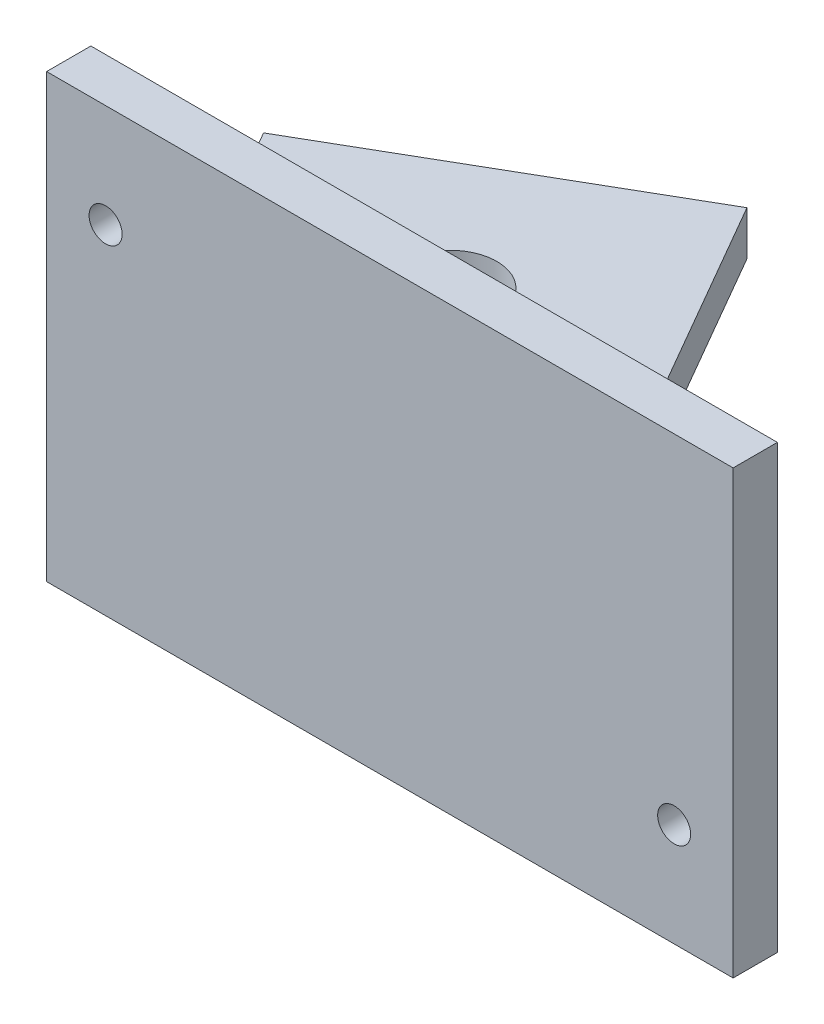
from build123d import *

# Parameters (mm, degrees)
SKETCH1_W           = 36.957
SKETCH1_H           = 21.3995
SKETCH1_R           = 0.889
BOSS_EXTRUDE1_DEPTH = 2.38125
BOSS_EXTRUDE3_DEPTH = 2.38125
CUT_EXTRUDE2_REACH  = 53.986
SKETCH4_R           = 2.4892


with BuildPart() as part:
    # Sketch1 → Boss-Extrude1 (new body)
    with BuildSketch(Plane.XY):
        with Locations((16.891, 9.11225)):
            Rectangle(SKETCH1_W, SKETCH1_H)
        with Locations((1.5875, 14.25575)):
            Circle(SKETCH1_R, mode=Mode.SUBTRACT)
        with Locations((32.1945, 1.5875)):
            Circle(SKETCH1_R, mode=Mode.SUBTRACT)
    extrude(amount=BOSS_EXTRUDE1_DEPTH)

    # Sketch2 → Boss-Extrude3 (add)
    with BuildSketch(Plane.XZ.offset(1.5875)):
        Polygon((-1.5875, 2.38125), (35.3695, 2.38125), (35.3695, 0), (20.409545256, 0), (2.210283942, -31.522045256), (-14.2875, -21.997045256), (-1.5875, 0), align=None)
    extrude(amount=BOSS_EXTRUDE3_DEPTH)

    # Sketch4 → Cut-Extrude2 (cut, up to next)
    with BuildSketch(Plane(origin=(0, -1.5875, 0), x_dir=(1, 0, 0), z_dir=(0, 1, 0)), mode=Mode.PRIVATE) as cut_extrude2_sk1:
        with Locations((-2.018977372, 19.797340731)):
            Circle(SKETCH4_R)
    cut_extrude2_tool1 = extrude(cut_extrude2_sk1.sketch, amount=-CUT_EXTRUDE2_REACH, mode=Mode.PRIVATE) & part.part
    # Sketch4 → Cut-Extrude2 (cut, up to next)
    with BuildSketch(Plane(origin=(0, -1.5875, 0), x_dir=(1, 0, 0), z_dir=(0, 1, 0)), mode=Mode.PRIVATE) as cut_extrude2_sk2:
        with Locations((4.331022628, 8.798818102)):
            Circle(SKETCH4_R)
    cut_extrude2_tool2 = extrude(cut_extrude2_sk2.sketch, amount=-CUT_EXTRUDE2_REACH, mode=Mode.PRIVATE) & part.part
    add(cut_extrude2_tool1.solids().sort_by_distance((-2.018977, -1.5875, -19.797341))[0], mode=Mode.SUBTRACT)
    add(cut_extrude2_tool2.solids().sort_by_distance((4.331023, -1.5875, -8.798818))[0], mode=Mode.SUBTRACT)


solid = part.part
